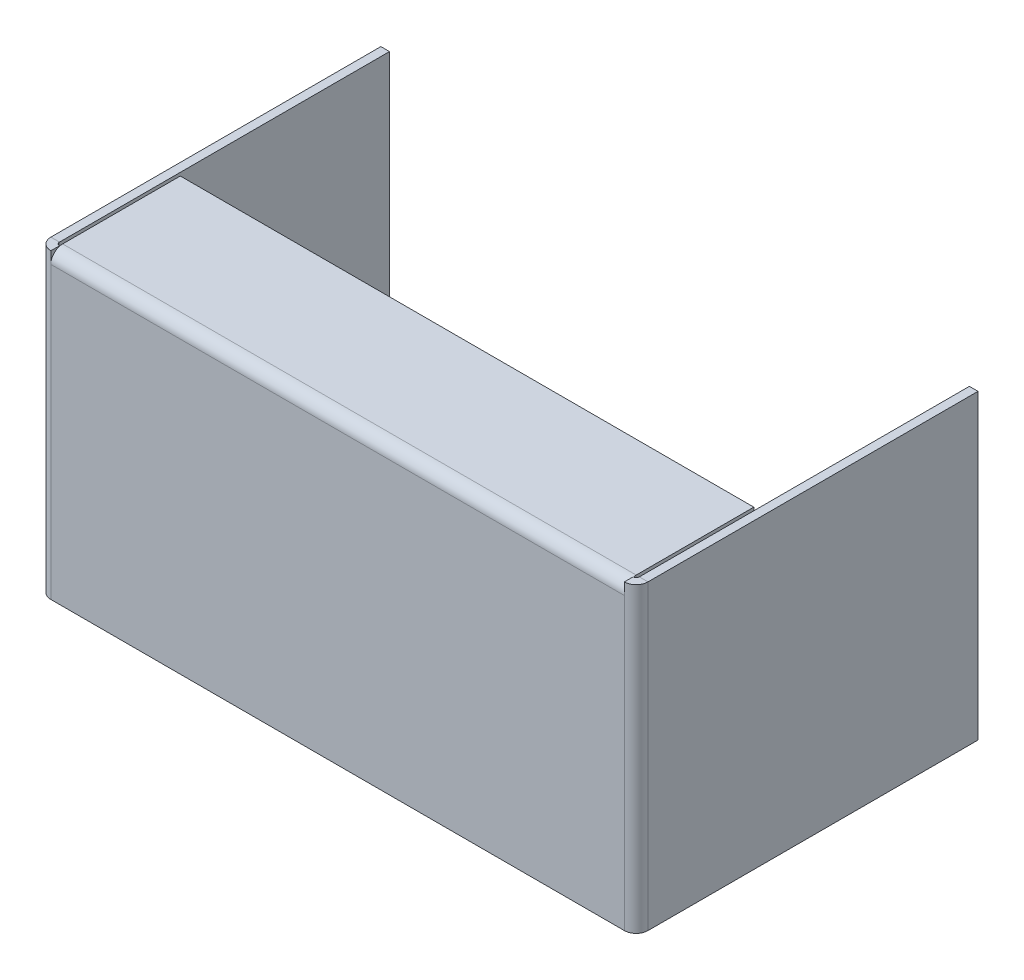
from build123d import *

# Parameters (mm, degrees)
BASE_FLANGE1_DEPTH           = 70
EDGE_FLANGE1_STRIP_W         = 9.4732
EDGE_FLANGE1_STRIP_H         = 2
EDGE_FLANGE1_STRIP_CUT_DEPTH = 132.921562236
EDGE_FLANGE1_DEPTH           = 132.921562236


# Sheet-metal steps are written as plain solids
with BuildPart() as part:
    # Sketch1 → Base-Flange1 (new body)
    with BuildSketch(Plane(origin=(0, 0, 0), x_dir=(1, 0, 0), z_dir=(0, 1, 0))):
        with BuildLine():
            Line((0, 77.222396617), (0, 0.7366))
            ThreePointArc((0, 0.7366), (0.215745145, 0.215745145), (0.7366, 0))
            Line((0.7366, 0), (133.658162236, 0))
            ThreePointArc((133.658162236, 0), (134.179017091, 0.215745145), (134.394762236, 0.7366))
            Line((134.394762236, 0.7366), (134.394762236, 77.222396617))
            Line((134.394762236, 77.222396617), (136.394762236, 77.222396617))
            Line((136.394762236, 77.222396617), (136.394762236, 0.7366))
            ThreePointArc((136.394762236, 0.7366), (135.593230653, -1.198468417), (133.658162236, -2))
            Line((133.658162236, -2), (0.7366, -2))
            ThreePointArc((0.7366, -2), (-1.198468417, -1.198468417), (-2, 0.7366))
            Line((-2, 0.7366), (-2, 77.222396617))
            Line((-2, 77.222396617), (0, 77.222396617))
        make_face()
    extrude(amount=BASE_FLANGE1_DEPTH)

    # Edge-Flange1 strip (across the edge) → Edge-Flange1 strip cut (cut)
    with BuildSketch(Plane(origin=(0.7366, 70, 0), x_dir=(0, -1, 0), z_dir=(1, 0, 0))):
        with Locations((-2, -1)):
            Rectangle(EDGE_FLANGE1_STRIP_W, EDGE_FLANGE1_STRIP_H)
    extrude(amount=EDGE_FLANGE1_STRIP_CUT_DEPTH, mode=Mode.SUBTRACT)

    # Edge-Flange1 section (across the edge) → Edge-Flange1 (add)
    with BuildSketch(Plane(origin=(0.7366, 70, 0), x_dir=(0, -1, 0), z_dir=(1, 0, 0))):
        with BuildLine():
            Line((0, 0.7366), (0, 28))
            Line((0, 28), (2, 28))
            Line((2, 28), (2, 0.7366))
            ThreePointArc((2, 0.7366), (2.215745145, 0.215745145), (2.7366, 0))
            Line((2.7366, 0), (2.7366, -2))
            ThreePointArc((2.7366, -2), (0.801531583, -1.198468417), (0, 0.7366))
        make_face()
    extrude(amount=EDGE_FLANGE1_DEPTH)


solid = part.part
